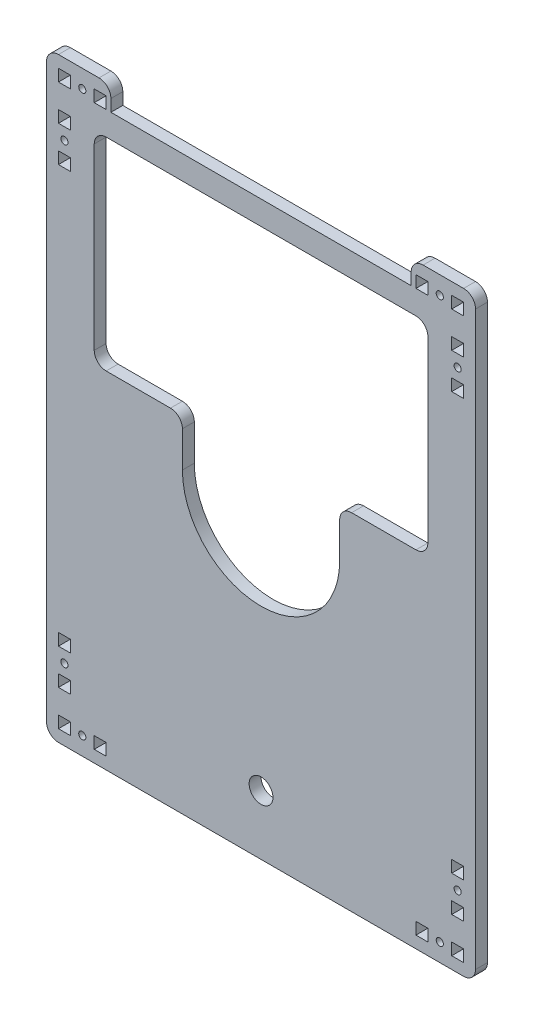
from build123d import *

# Parameters (mm, degrees)
SKETCH1_R           = 5
SKETCH1_R_2         = 1.5
SKETCH1_W           = 5
SKETCH1_H           = 5
BOSS_EXTRUDE1_DEPTH = 5
FILLET1_R           = 5


with BuildPart() as part:
    # Sketch1 → Boss-Extrude1 (new body)
    with BuildSketch(Plane.XY):
        Polygon((-90, 125), (-90, -125), (90, -125), (90, 125), (63, 125), (63, 115), (-63, 115), (-63, 125), align=None)
        with Locations((0, -100)):
            Circle(SKETCH1_R, mode=Mode.SUBTRACT)
        with Locations((-75, 117.5)):
            Circle(SKETCH1_R_2, mode=Mode.SUBTRACT)
        with Locations((-75, -117.5)):
            Circle(SKETCH1_R_2, mode=Mode.SUBTRACT)
        with Locations((75, -117.5)):
            Circle(SKETCH1_R_2, mode=Mode.SUBTRACT)
        with Locations((75, 117.5)):
            Circle(SKETCH1_R_2, mode=Mode.SUBTRACT)
        with Locations((82.5, 95)):
            Circle(SKETCH1_R_2, mode=Mode.SUBTRACT)
        with Locations((82.5, -95)):
            Circle(SKETCH1_R_2, mode=Mode.SUBTRACT)
        with Locations((-82.5, 95)):
            Circle(SKETCH1_R_2, mode=Mode.SUBTRACT)
        with Locations((-82.5, -95)):
            Circle(SKETCH1_R_2, mode=Mode.SUBTRACT)
        with BuildLine():
            Line((-70, 105), (70, 105))
            Line((70, 105), (70, 20))
            Line((70, 20), (33, 20))
            Line((33, 20), (33, 0))
            ThreePointArc((33, 0), (0, -33), (-33, 0))
            Line((-33, 0), (-33, 20))
            Line((-33, 20), (-70, 20))
            Line((-70, 20), (-70, 105))
        make_face(mode=Mode.SUBTRACT)
        with Locations((-82.5, 117.5)):
            Rectangle(SKETCH1_W, SKETCH1_H, mode=Mode.SUBTRACT)
        with Locations((-67.5, 117.5)):
            Rectangle(SKETCH1_W, SKETCH1_H, mode=Mode.SUBTRACT)
        with Locations((-82.5, -117.5)):
            Rectangle(SKETCH1_W, SKETCH1_H, mode=Mode.SUBTRACT)
        with Locations((-67.5, -117.5)):
            Rectangle(SKETCH1_W, SKETCH1_H, mode=Mode.SUBTRACT)
        with Locations((82.5, -117.5)):
            Rectangle(SKETCH1_W, SKETCH1_H, mode=Mode.SUBTRACT)
        with Locations((67.5, -117.5)):
            Rectangle(SKETCH1_W, SKETCH1_H, mode=Mode.SUBTRACT)
        with Locations((82.5, 117.5)):
            Rectangle(SKETCH1_W, SKETCH1_H, mode=Mode.SUBTRACT)
        with Locations((67.5, 117.5)):
            Rectangle(SKETCH1_W, SKETCH1_H, mode=Mode.SUBTRACT)
        with Locations((82.5, 102.5)):
            Rectangle(SKETCH1_W, SKETCH1_H, mode=Mode.SUBTRACT)
        with Locations((82.5, 87.5)):
            Rectangle(SKETCH1_W, SKETCH1_H, mode=Mode.SUBTRACT)
        with Locations((82.5, -102.5)):
            Rectangle(SKETCH1_W, SKETCH1_H, mode=Mode.SUBTRACT)
        with Locations((82.5, -87.5)):
            Rectangle(SKETCH1_W, SKETCH1_H, mode=Mode.SUBTRACT)
        with Locations((-82.5, 102.5)):
            Rectangle(SKETCH1_W, SKETCH1_H, mode=Mode.SUBTRACT)
        with Locations((-82.5, 87.5)):
            Rectangle(SKETCH1_W, SKETCH1_H, mode=Mode.SUBTRACT)
        with Locations((-82.5, -102.5)):
            Rectangle(SKETCH1_W, SKETCH1_H, mode=Mode.SUBTRACT)
        with Locations((-82.5, -87.5)):
            Rectangle(SKETCH1_W, SKETCH1_H, mode=Mode.SUBTRACT)
    extrude(amount=BOSS_EXTRUDE1_DEPTH)

    # Fillet1
    fillet1_edges = [part.edges().sort_by_distance(p)[0] for p in [
        (-90, -125, 2.5),
        (90, -125, 2.5),
        (90, 125, 2.5),
        (63, 125, 2.5),
        (-90, 125, 2.5),
        (-63, 125, 2.5),
        (-70, 105, 2.5),
        (70, 105, 2.5),
        (70, 20, 2.5),
        (33, 20, 2.5),
        (-70, 20, 2.5),
        (-33, 20, 2.5),
    ]]
    fillet(fillet1_edges, radius=FILLET1_R)


solid = part.part
